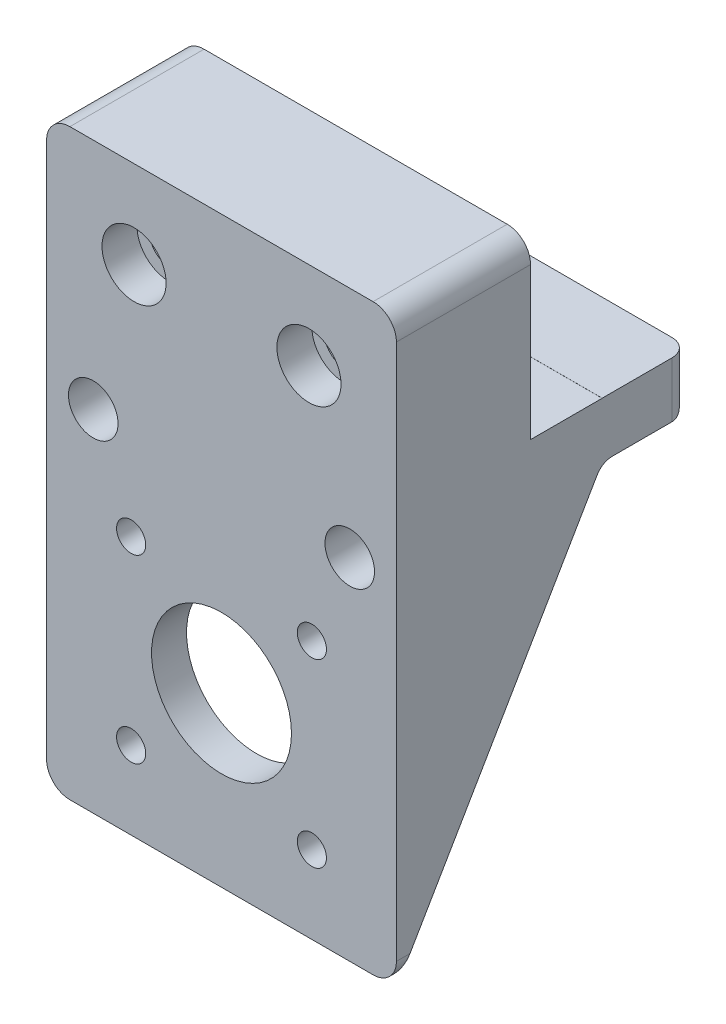
from build123d import *

# Parameters (mm, degrees)
ESBO_O1_R                         = 12
ESBO_O1_R_2                       = 2.5
RESSALTO_EXTRUS_O1_DEPTH          = 6
RESSALTO_EXTRUS_O2_START          = 50
RESSALTO_EXTRUS_O2_DEPTH          = 50
CORTE_EXTRUS_O1_DEPTH             = 122.844532089
ESBO_O5_R                         = 4.25
CORTE_EXTRUS_O2_DEPTH             = 15
REBAIXO_PARA_SHCS_M61_D           = 6.6
REBAIXO_PARA_SHCS_M61_CBORE_D     = 11
REBAIXO_PARA_SHCS_M61_CBORE_DEPTH = 6
CORTE_EXTRUS_O3_DEPTH             = 122.844532089
ESBO_O4_W                         = 60
ESBO_O4_H                         = 9.5
RESSALTO_EXTRUS_O3_DEPTH          = 15
FILETE1_R                         = 3


with BuildPart() as part:
    # Esboço1 → Ressalto-extrusão1 (new body)
    with BuildSketch(Plane.XY.offset(29.3)):
        with BuildLine():
            Line((-245.980789633, -100), (-193.980789633, -100))
            ThreePointArc((-193.980789633, -100), (-191.152362508, -98.828427125), (-189.980789633, -96))
            Line((-189.980789633, -96), (-189.980789633, -4))
            ThreePointArc((-189.980789633, -4), (-191.152362508, -1.171572875), (-193.980789633, 0))
            Line((-193.980789633, 0), (-245.980789633, 0))
            ThreePointArc((-245.980789633, 0), (-248.809216758, -1.171572875), (-249.980789633, -4))
            Line((-249.980789633, -4), (-249.980789633, -96))
            ThreePointArc((-249.980789633, -96), (-248.809216758, -98.828427125), (-245.980789633, -100))
        make_face()
        with Locations((-219.980789633, -71.15)):
            Circle(ESBO_O1_R, mode=Mode.SUBTRACT)
        with Locations((-235.480789633, -86.65)):
            Circle(ESBO_O1_R_2, mode=Mode.SUBTRACT)
        with Locations((-235.480789633, -55.65)):
            Circle(ESBO_O1_R_2, mode=Mode.SUBTRACT)
        with Locations((-204.480789633, -86.65)):
            Circle(ESBO_O1_R_2, mode=Mode.SUBTRACT)
        with Locations((-204.480789633, -55.65)):
            Circle(ESBO_O1_R_2, mode=Mode.SUBTRACT)
    extrude(amount=RESSALTO_EXTRUS_O1_DEPTH)

    # Esboço2 → Ressalto-extrusão2 (add)
    with BuildSketch(Plane(origin=(0, 0, 29.3), x_dir=(-1, 0, 0), z_dir=(0, 0, -1)).offset(RESSALTO_EXTRUS_O2_START)):
        with BuildLine():
            Line((189.980789633, -4), (189.980789633, -96))
            ThreePointArc((189.980789633, -96), (191.152362508, -98.828427125), (193.980789633, -100))
            Line((193.980789633, -100), (245.980789633, -100))
            ThreePointArc((245.980789633, -100), (248.809216758, -98.828427125), (249.980789633, -96))
            Line((249.980789633, -96), (249.980789633, -4))
            ThreePointArc((249.980789633, -4), (248.809216758, -1.171572875), (245.980789633, 0))
            Line((245.980789633, 0), (193.980789633, 0))
            ThreePointArc((193.980789633, 0), (191.152362508, -1.171572875), (189.980789633, -4))
        make_face()
        Polygon((237.959216758, -48), (202.002362508, -48), (196.830789633, -53.171572875), (196.830789633, -89.128427125), (202.002362508, -94.3), (237.959216758, -94.3), (243.130789633, -89.128427125), (243.130789633, -53.171572875), align=None, mode=Mode.SUBTRACT)
    extrude(amount=-RESSALTO_EXTRUS_O2_DEPTH)

    # Esboço3 → Corte-extrusão1 (cut, through all)
    with BuildSketch(Plane.ZY.offset(249.980789633)):
        Polygon((35.3, -100), (-20.7, -100), (-20.7, -31.056412858), (0, -31.056412858), (0, -39.485714286), align=None)
    extrude(amount=-CORTE_EXTRUS_O1_DEPTH, mode=Mode.SUBTRACT)

    # Esboço5 → Corte-extrusão2 (cut)
    with BuildSketch(Plane.XY.offset(35.3)):
        with Locations((-241.980789633, -40)):
            Circle(ESBO_O5_R)
        with Locations((-197.980789633, -40)):
            Circle(ESBO_O5_R)
    extrude(amount=-CORTE_EXTRUS_O2_DEPTH, mode=Mode.SUBTRACT)

    # Rebaixo para SHCS M61 (through all)
    with Locations(Plane.XY.offset(35.3)):
        with Locations((-234.980789633, -15), (-204.980789633, -15)):
            CounterBoreHole(REBAIXO_PARA_SHCS_M61_D / 2, REBAIXO_PARA_SHCS_M61_CBORE_D / 2, REBAIXO_PARA_SHCS_M61_CBORE_DEPTH)

    # Esboço10 → Corte-extrusão3 (cut, through all)
    with BuildSketch(Plane.ZY.offset(249.980789633)):
        Polygon((12.291276716, 1.7848e-05), (-27.708723284, 1.7848e-05), (-27.708723284, -29.999982152), (-21.235336221, -29.999982152), (-21.235336221, -31.532793492), (0, -31.532793492), (0, -29.999982152), (12.291276716, -29.999982152), align=None)
    extrude(amount=-CORTE_EXTRUS_O3_DEPTH, mode=Mode.SUBTRACT)

    # Esboço4 → Ressalto-extrusão3 (add)
    with BuildSketch(Plane(origin=(0, 0, 0), x_dir=(-1, 0, 0), z_dir=(0, 0, -1))):
        with Locations((219.980789633, -34.735714286)):
            Rectangle(ESBO_O4_W, ESBO_O4_H)
    extrude(amount=RESSALTO_EXTRUS_O3_DEPTH)

    # Filete1
    filete1_edges = [part.edges().sort_by_distance(p)[0] for p in [
        (-219.980789633, -39.485714286, 0),
        (-249.980789633, -34.735714286, -15),
        (-189.980789633, -34.735714286, -15),
        (-219.980789633, -39.485714286, -15),
    ]]
    fillet(filete1_edges, radius=FILETE1_R)


solid = part.part
